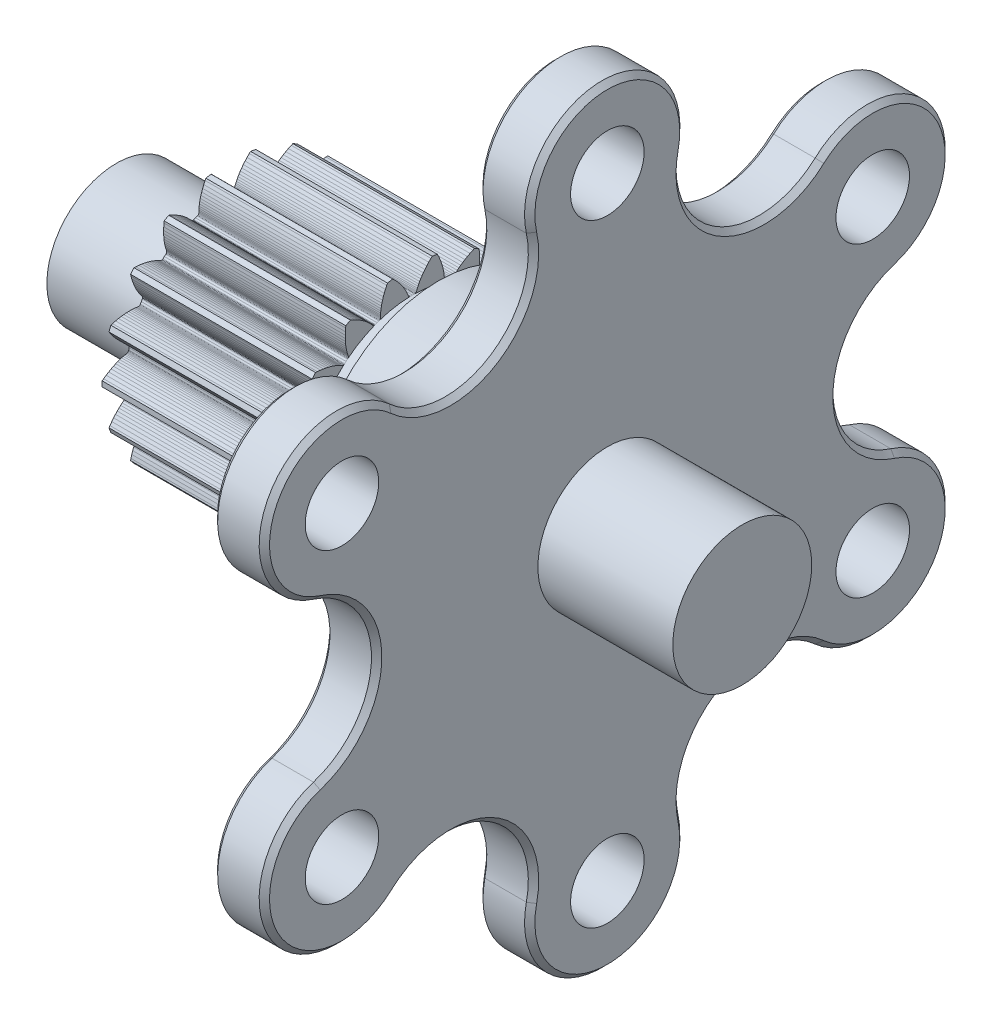
from build123d import *

# Parameters (mm, degrees)
SKETCH1_R              = 47
BASE_EXTRUDE_DEPTH     = 6.35
M8_CLEARANCE_HOLES_D   = 9
CIRPATTERN_COUNT       = 6
CUT_EXTRUDE_DEPTH      = 67.770670957
CUT_EXTRUDE_DEPTH_BACK = 67.770670957
CHAMFER1_SIZE          = 0.635
SKETCH8_R              = 15.748
SHAFT_EXTRUDE_DEPTH    = 52.5820005
CHAMFER3_SIZE          = 0.635
SHAFT_CHAMFER_SIZE     = 1
CUT_EXTRUDE1_START     = -12.856999432
SKETCH45_R             = 15.748
SKETCH45_R_2           = 8.5127
CUT_EXTRUDE1_DEPTH     = 12.856999432
SKETCH55_R             = 8.5
BOSS_EXTRUDE4_DEPTH    = 16.51
SKETCH56_R             = 8.5127
BOSS_EXTRUDE5_DEPTH    = 1.143
FILLET9_R              = 1.524
SKETCH66_R             = 13.97
SKETCH66_R_2           = 12.3825
CUT_EXTRUDE11_DEPTH    = 2.54
CUT_EXTRUDE16_START    = -22.225
CUT_EXTRUDE16_DEPTH    = 22.225
CUT_EXTRUDE17_START    = -3.175
SKETCH90_R             = 15.748
SKETCH90_R_2           = 12.650042794
CUT_EXTRUDE17_DEPTH    = 3.175
BOSS_EXTRUDE11_START   = -3.175
SKETCH91_R             = 15.748
BOSS_EXTRUDE11_DEPTH   = 3.175
BOSS_EXTRUDE12_START   = 3.175
SKETCH92_R             = 12.650042794
BOSS_EXTRUDE12_DEPTH   = 3.175


with BuildPart() as part:
    # Sketch1 → Base-Extrude (new body)
    with BuildSketch(Plane(origin=(0, 0, 0), x_dir=(0, 0, -1), z_dir=(1, 0, 0))):
        Circle(SKETCH1_R)
    extrude(amount=-BASE_EXTRUDE_DEPTH)

    # M8 Clearance Holes (through all)
    with Locations(Plane(origin=(0, 0, 0), x_dir=(0, 0, -1), z_dir=(1, 0, 0))):
        with Locations((0, -37.5)):
            m8_clearance_holes = Hole(M8_CLEARANCE_HOLES_D / 2)

    # CirPattern: M8 Clearance Holes ×6 about axis
    cirpattern_axis = Axis((-6.35, 0, 0), (1, 0, 0))
    for i in range(1, CIRPATTERN_COUNT):
        add(m8_clearance_holes.rotate(cirpattern_axis, i * 360 / CIRPATTERN_COUNT), mode=Mode.SUBTRACT)

    # Sketch19 → Cut-Extrude (cut, two sides: drawn at the far end of the back side and taken through both)
    with BuildSketch(Plane(origin=(0, 0, 0), x_dir=(0, 0, -1), z_dir=(1, 0, 0)).offset(-CUT_EXTRUDE_DEPTH_BACK)):
        with BuildLine():
            ThreePointArc((9.274838239, 35.443941724), (14.114033661, 24.446223401), (26.057934823, 25.754216393))
            ThreePointArc((26.057934823, 25.754216393), (33.921184851, 28.139425108), (40.703194264, 23.499999504))
            ThreePointArc((40.703194264, 23.499999504), (23.500000227, 40.703193847), (-4.7e-08, 47))
            ThreePointArc((-4.7e-08, 47), (7.40886473, 43.446320157), (9.274838239, 35.443941724))
        make_face()
        with BuildLine():
            ThreePointArc((-26.057934823, 25.754216393), (-14.114033661, 24.446223401), (-9.274838239, 35.443941724))
            ThreePointArc((-9.274838239, 35.443941724), (-7.40886476, 43.44632012), (-4.7e-08, 47))
            ThreePointArc((-4.7e-08, 47), (-23.500000787, 40.703193523), (-40.703194863, 23.499998466))
            ThreePointArc((-40.703194863, 23.499998466), (-33.921185443, 28.139425017), (-26.057934823, 25.754216393))
        make_face()
        with BuildLine():
            ThreePointArc((40.703193464, -23.50000089), (47, -8e-07), (40.703194264, 23.499999504))
            ThreePointArc((40.703194264, 23.499999504), (41.33004921, 15.30689472), (35.332773062, 9.689725331))
            ThreePointArc((35.332773062, 9.689725331), (28.228067323, 0), (35.332773062, -9.689725331))
            ThreePointArc((35.332773062, -9.689725331), (41.330049499, -15.306895465), (40.703193464, -23.50000089))
        make_face()
        with BuildLine():
            ThreePointArc((-35.332773062, 9.689725331), (-41.330048992, 15.306894161), (-40.703194863, 23.499998466))
            ThreePointArc((-40.703194863, 23.499998466), (-47, -6.9e-08), (-40.703194794, -23.499998586))
            ThreePointArc((-40.703194794, -23.499998586), (-41.330049018, -15.306894226), (-35.332773062, -9.689725331))
            ThreePointArc((-35.332773062, -9.689725331), (-28.228067323, 0), (-35.332773062, 9.689725331))
        make_face()
        with BuildLine():
            ThreePointArc((-26.057934823, -25.754216393), (-33.921185375, -28.139425028), (-40.703194794, -23.499998586))
            ThreePointArc((-40.703194794, -23.499998586), (-23.500000688, -40.703193581), (4.4e-08, -47))
            ThreePointArc((4.4e-08, -47), (-7.408864732, -43.446320155), (-9.274838239, -35.443941724))
            ThreePointArc((-9.274838239, -35.443941724), (-14.114033661, -24.446223401), (-26.057934823, -25.754216393))
        make_face()
        with BuildLine():
            ThreePointArc((4.4e-08, -47), (23.499999574, -40.703194224), (40.703193464, -23.50000089))
            ThreePointArc((40.703193464, -23.50000089), (33.92118406, -28.13942523), (26.057934823, -25.754216393))
            ThreePointArc((26.057934823, -25.754216393), (14.114033661, -24.446223401), (9.274838239, -35.443941724))
            ThreePointArc((9.274838239, -35.443941724), (7.408864759, -43.446320121), (4.4e-08, -47))
        make_face()
    extrude(amount=CUT_EXTRUDE_DEPTH + CUT_EXTRUDE_DEPTH_BACK, mode=Mode.SUBTRACT)

    # Chamfer1
    chamfer1_edges = [part.edges().sort_by_distance(p)[0] for p in [
        (-6.35, 0, 28.228067323),
        (-6.35, -23.5, 40.703193978),
        (-6.35, 23.5, 40.703193978),
        (-6.35, -24.446223401, 14.114033661),
        (-6.35, 24.446223401, 14.114033661),
        (-6.35, -47, 0),
        (-6.35, 47, 0),
        (-6.35, -24.446223401, -14.114033661),
        (-6.35, -23.5, -40.703193978),
        (-6.35, 0, -28.228067323),
        (-6.35, 23.5, -40.703193978),
        (-6.35, 24.446223401, -14.114033661),
    ]]
    chamfer(chamfer1_edges, length=CHAMFER1_SIZE)

    # Sketch8 → Shaft-Extrude (add)
    with BuildSketch(Plane.ZY.offset(6.35)):
        Circle(SKETCH8_R)
    extrude(amount=SHAFT_EXTRUDE_DEPTH)

    # Chamfer3
    chamfer3_edges = [part.edges().sort_by_distance(p)[0] for p in [
        (0, -23.5, 40.703193978),
        (0, 0, 28.228067323),
        (0, -24.446223401, 14.114033661),
        (0, 23.5, 40.703193978),
        (0, -47, 0),
        (0, 24.446223401, 14.114033661),
        (0, -24.446223401, -14.114033661),
        (0, 47, 0),
        (0, 24.446223401, -14.114033661),
        (0, -23.5, -40.703193978),
        (0, 0, -28.228067323),
        (0, 23.5, -40.703193978),
    ]]
    chamfer(chamfer3_edges, length=CHAMFER3_SIZE)

    # Shaft Chamfer
    shaft_chamfer_edges = [part.edges().sort_by_distance(p)[0] for p in [
        (-58.9320005, 0, -15.748),
    ]]
    chamfer(shaft_chamfer_edges, length=SHAFT_CHAMFER_SIZE)

    # Sketch45 → Cut-Extrude1 (cut)
    with BuildSketch(Plane.ZY.offset(58.9320005).offset(CUT_EXTRUDE1_START)):
        Circle(SKETCH45_R)
        Circle(SKETCH45_R_2, mode=Mode.SUBTRACT)
    extrude(amount=CUT_EXTRUDE1_DEPTH, mode=Mode.SUBTRACT)

    # Sketch55 → Boss-Extrude4 (add)
    with BuildSketch(Plane(origin=(0, 0, 0), x_dir=(0, 0, -1), z_dir=(1, 0, 0))):
        Circle(SKETCH55_R)
    extrude(amount=BOSS_EXTRUDE4_DEPTH)

    # Sketch56 → Boss-Extrude5 (add)
    with BuildSketch(Plane.ZY.offset(58.9320005)):
        Circle(SKETCH56_R)
    extrude(amount=BOSS_EXTRUDE5_DEPTH)

    # Fillet9
    fillet9_edges = [part.edges().sort_by_distance(p)[0] for p in [
        (-46.075001068, 0, -8.5127),
    ]]
    fillet(fillet9_edges, radius=FILLET9_R)

    # Sketch66 → Cut-Extrude11 (cut)
    with BuildSketch(Plane.ZY.offset(22.0004005)):
        Circle(SKETCH66_R)
        Circle(SKETCH66_R_2, mode=Mode.SUBTRACT)
    extrude(amount=-CUT_EXTRUDE11_DEPTH, mode=Mode.SUBTRACT)

    # Sketch89 → Cut-Extrude16 (cut)
    with BuildSketch(Plane.ZY.offset(46.075001068).offset(CUT_EXTRUDE16_START)):
        with BuildLine():
            Line((14.905662373, 5.081410553), (14.7872836, 4.8999562))
            Line((14.7872836, 4.8999562), (14.5639901, 4.5862254))
            Line((14.5639901, 4.5862254), (14.3413189, 4.2995436))
            Line((14.3413189, 4.2995436), (14.1194165, 4.0372965))
            Line((14.1194165, 4.0372965), (13.9032487, 3.8025328))
            Line((13.9032487, 3.8025328), (13.6912318, 3.5907592))
            Line((13.6912318, 3.5907592), (13.4871377, 3.4033311))
            Line((13.4871377, 3.4033311), (13.2928477, 3.2393112))
            Line((13.2928477, 3.2393112), (13.106944, 3.0952812))
            Line((13.106944, 3.0952812), (12.9348864, 2.9731584))
            Line((12.9348864, 2.9731584), (12.774825, 2.8693266))
            Line((12.774825, 2.8693266), (12.6451501, 2.7921869))
            Line((12.6451501, 2.7921869), (12.5432319, 2.7213528))
            Line((12.5432319, 2.7213528), (12.5028003, 2.684827))
            Line((12.5028003, 2.684827), (12.469389, 2.6479348))
            Line((12.469389, 2.6479348), (12.4430003, 2.6109505))
            Line((12.4430003, 2.6109505), (12.4236152, 2.5741554))
            Line((12.4236152, 2.5741554), (12.4112164, 2.5378203))
            Line((12.4112164, 2.5378203), (12.4057633, 2.5022327))
            Line((12.4057633, 2.5022327), (12.4072206, 2.4676504))
            Line((12.4072206, 2.4676504), (12.4155284, 2.4245076))
            Line((12.4155284, 2.4245076), (12.4578181, 2.1966494))
            Line((12.4578181, 2.1966494), (12.4960109, 1.9680689))
            Line((12.4960109, 1.9680689), (12.5029598, 1.9246865))
            Line((12.5029598, 1.9246865), (12.5134182, 1.8916913))
            Line((12.5134182, 1.8916913), (12.5307141, 1.860115))
            Line((12.5307141, 1.860115), (12.5547926, 1.8302119))
            Line((12.5547926, 1.8302119), (12.5855933, 1.8022658))
            Line((12.5855933, 1.8022658), (12.6230398, 1.7765375))
            Line((12.6230398, 1.7765375), (12.6670541, 1.7532974))
            Line((12.6670541, 1.7532974), (12.71754, 1.7328028))
            Line((12.71754, 1.7328028), (12.8375384, 1.7010987))
            Line((12.8375384, 1.7010987), (12.9857762, 1.6729624))
            Line((12.9857762, 1.6729624), (13.1716974, 1.6301367))
            Line((13.1716974, 1.6301367), (13.3751471, 1.5742259))
            Line((13.3751471, 1.5742259), (13.5991006, 1.5024649))
            Line((13.5991006, 1.5024649), (13.8377716, 1.4147876))
            Line((13.8377716, 1.4147876), (14.0936614, 1.3084672))
            Line((14.0936614, 1.3084672), (14.365323, 1.1819791))
            Line((14.365323, 1.1819791), (14.6487482, 1.0353071))
            Line((14.6487482, 1.0353071), (14.9469621, 0.8647705))
            Line((14.9469621, 0.8647705), (15.2542554, 0.6715358))
            Line((15.2542554, 0.6715358), (15.571385, 0.4530962))
            Line((15.571385, 0.4530962), (15.744685707, 0.323072753))
            ThreePointArc((15.744685707, 0.323072753), (15.508752497, 2.734611488), (14.905662373, 5.081410553))
        make_face()
        with BuildLine():
            Line((14.4773476, 5.7514985), (14.68466758, 5.688588758))
            ThreePointArc((14.68466758, 5.688588758), (13.638168057, 7.874000004), (12.268796161, 9.873000798))
            Line((12.268796161, 9.873000798), (12.2196176, 9.6620015))
            Line((12.2196176, 9.6620015), (12.1170925, 9.2908201))
            Line((12.1170925, 9.2908201), (12.0059011, 8.9452694))
            Line((12.0059011, 8.9452694), (11.8870747, 8.6229426))
            Line((11.8870747, 8.6229426), (11.7642374, 8.3284031))
            Line((11.7642374, 8.3284031), (11.6374375, 8.0568869))
            Line((11.6374375, 8.0568869), (11.509756, 7.8109579))
            Line((11.509756, 7.8109579), (11.3832812, 7.5903785))
            Line((11.3832812, 7.5903785), (11.25785, 7.3914518))
            Line((11.25785, 7.3914518), (11.1379373, 7.2178467))
            Line((11.1379373, 7.2178467), (11.0230413, 7.0655325))
            Line((11.0230413, 7.0655325), (10.9275701, 6.9486934))
            Line((10.9275701, 6.9486934), (10.856025, 6.8472732))
            Line((10.856025, 6.8472732), (10.8305243, 6.7991217))
            Line((10.8305243, 6.7991217), (10.8117458, 6.753027))
            Line((10.8117458, 6.753027), (10.7995979, 6.7092477))
            Line((10.7995979, 6.7092477), (10.7939666, 6.6680415))
            Line((10.7939666, 6.6680415), (10.7947428, 6.629657))
            Line((10.7947428, 6.629657), (10.8017902, 6.5943506))
            Line((10.8017902, 6.5943506), (10.8149875, 6.5623522))
            Line((10.8149875, 6.5623522), (10.83755, 6.5246527))
            Line((10.83755, 6.5246527), (10.9552214, 6.325))
            Line((10.9552214, 6.325), (11.06929, 6.1232673))
            Line((11.06929, 6.1232673), (11.0906575, 6.0848778))
            Line((11.0906575, 6.0848778), (11.1117702, 6.0574494))
            Line((11.1117702, 6.0574494), (11.1388228, 6.033693))
            Line((11.1388228, 6.033693), (11.1716766, 6.0138285))
            Line((11.1716766, 6.0138285), (11.2101779, 5.9981023))
            Line((11.2101779, 5.9981023), (11.2541658, 5.986733))
            Line((11.2541658, 5.986733), (11.3034743, 5.9799483))
            Line((11.3034743, 5.9799483), (11.357925, 5.9779568))
            Line((11.357925, 5.9779568), (11.4815301, 5.9892066))
            Line((11.4815301, 5.9892066), (11.6304513, 6.0134675))
            Line((11.6304513, 6.0134675), (11.8198073, 6.0368133))
            Line((11.8198073, 6.0368133), (12.03011, 6.0538582))
            Line((12.03011, 6.0538582), (12.2651012, 6.0630215))
            Line((12.2651012, 6.0630215), (12.519366, 6.0622621))
            Line((12.519366, 6.0622621), (12.7961875, 6.0498731))
            Line((12.7961875, 6.0498731), (13.0947274, 6.0239269))
            Line((13.0947274, 6.0239269), (13.4112247, 5.9830374))
            Line((13.4112247, 5.9830374), (13.7497811, 5.9247806))
            Line((13.7497811, 5.9247806), (14.1046325, 5.8482999))
            Line((14.1046325, 5.8482999), (14.4773476, 5.7514985))
        make_face()
        with BuildLine():
            ThreePointArc((14.905662372, -5.081410558), (15.508752496, -2.734611494), (15.744685706, -0.323072759))
            Line((15.744685706, -0.323072759), (15.571385, -0.4530962))
            Line((15.571385, -0.4530962), (15.2542554, -0.6715358))
            Line((15.2542554, -0.6715358), (14.9469621, -0.8647705))
            Line((14.9469621, -0.8647705), (14.6487482, -1.0353071))
            Line((14.6487482, -1.0353071), (14.365323, -1.1819791))
            Line((14.365323, -1.1819791), (14.0936614, -1.3084672))
            Line((14.0936614, -1.3084672), (13.8377716, -1.4147876))
            Line((13.8377716, -1.4147876), (13.5991006, -1.5024649))
            Line((13.5991006, -1.5024649), (13.3751471, -1.5742259))
            Line((13.3751471, -1.5742259), (13.1716974, -1.6301367))
            Line((13.1716974, -1.6301367), (12.9857762, -1.6729624))
            Line((12.9857762, -1.6729624), (12.8375384, -1.7010987))
            Line((12.8375384, -1.7010987), (12.71754, -1.7328028))
            Line((12.71754, -1.7328028), (12.6670541, -1.7532974))
            Line((12.6670541, -1.7532974), (12.6230398, -1.7765375))
            Line((12.6230398, -1.7765375), (12.5855933, -1.8022658))
            Line((12.5855933, -1.8022658), (12.5547926, -1.8302119))
            Line((12.5547926, -1.8302119), (12.5307141, -1.860115))
            Line((12.5307141, -1.860115), (12.5134182, -1.8916913))
            Line((12.5134182, -1.8916913), (12.5029598, -1.9246865))
            Line((12.5029598, -1.9246865), (12.4960109, -1.9680689))
            Line((12.4960109, -1.9680689), (12.4578181, -2.1966494))
            Line((12.4578181, -2.1966494), (12.4155284, -2.4245076))
            Line((12.4155284, -2.4245076), (12.4072206, -2.4676504))
            Line((12.4072206, -2.4676504), (12.4057633, -2.5022327))
            Line((12.4057633, -2.5022327), (12.4112164, -2.5378203))
            Line((12.4112164, -2.5378203), (12.4236152, -2.5741554))
            Line((12.4236152, -2.5741554), (12.4430003, -2.6109505))
            Line((12.4430003, -2.6109505), (12.469389, -2.6479348))
            Line((12.469389, -2.6479348), (12.5028003, -2.684827))
            Line((12.5028003, -2.684827), (12.5432319, -2.7213528))
            Line((12.5432319, -2.7213528), (12.6451501, -2.7921869))
            Line((12.6451501, -2.7921869), (12.774825, -2.8693266))
            Line((12.774825, -2.8693266), (12.9348864, -2.9731584))
            Line((12.9348864, -2.9731584), (13.106944, -3.0952812))
            Line((13.106944, -3.0952812), (13.2928477, -3.2393112))
            Line((13.2928477, -3.2393112), (13.4871377, -3.4033311))
            Line((13.4871377, -3.4033311), (13.6912318, -3.5907592))
            Line((13.6912318, -3.5907592), (13.9032487, -3.8025328))
            Line((13.9032487, -3.8025328), (14.1194165, -4.0372965))
            Line((14.1194165, -4.0372965), (14.3413189, -4.2995436))
            Line((14.3413189, -4.2995436), (14.5639901, -4.5862254))
            Line((14.5639901, -4.5862254), (14.7872836, -4.8999562))
            Line((14.7872836, -4.8999562), (14.905662372, -5.081410558))
        make_face()
        with BuildLine():
            Line((11.6371283, 10.3561852), (11.853461816, 10.367976995))
            ThreePointArc((11.853461816, 10.367976995), (10.122619272, 12.063667894), (8.152132074, 13.473761414))
            Line((8.152132074, 13.473761414), (8.1780853, 13.2586669))
            Line((8.1780853, 13.2586669), (8.2086948, 12.8748048))
            Line((8.2086948, 12.8748048), (8.2223943, 12.5120636))
            Line((8.2223943, 12.5120636), (8.2209763, 12.1685346))
            Line((8.2209763, 12.1685346), (8.2062854, 11.8497451))
            Line((8.2062854, 11.8497451), (8.1799965, 11.5512353))
            Line((8.1799965, 11.5512353), (8.1441278, 11.2764679))
            Line((8.1441278, 11.2764679), (8.100723, 11.0259342))
            Line((8.100723, 11.0259342), (8.0508932, 10.7961042))
            Line((8.0508932, 10.7961042), (7.9975885, 10.5919562))
            Line((7.9975885, 10.5919562), (7.9417161, 10.4095309))
            Line((7.9417161, 10.4095309), (7.8919638, 10.267085))
            Line((7.8919638, 10.267085), (7.8594212, 10.1473113))
            Line((7.8594212, 10.1473113), (7.8519271, 10.093342))
            Line((7.8519271, 10.093342), (7.8500465, 10.0436044))
            Line((7.8500465, 10.0436044), (7.8536046, 9.9983106))
            Line((7.8536046, 9.9983106), (7.8624063, 9.9576633))
            Line((7.8624063, 9.9576633), (7.8762639, 9.9218593))
            Line((7.8762639, 9.9218593), (7.8949618, 9.8910924))
            Line((7.8949618, 9.8910924), (7.9183073, 9.8655375))
            Line((7.9183073, 9.8655375), (7.9524031, 9.8378284))
            Line((7.9524031, 9.8378284), (8.1312633, 9.6904622))
            Line((8.1312633, 9.6904622), (8.3074494, 9.5399092))
            Line((8.3074494, 9.5399092), (8.3406582, 9.511143))
            Line((8.3406582, 9.511143), (8.3698787, 9.4925898))
            Line((8.3698787, 9.4925898), (8.403425, 9.4795185))
            Line((8.403425, 9.4795185), (8.4410916, 9.4720887))
            Line((8.4410916, 9.4720887), (8.4826497, 9.4704791))
            Line((8.4826497, 9.4704791), (8.5278733, 9.4748403))
            Line((8.5278733, 9.4748403), (8.5765286, 9.4853292))
            Line((8.5765286, 9.4853292), (8.6283766, 9.5020811))
            Line((8.6283766, 9.5020811), (8.7406798, 9.5549278))
            Line((8.7406798, 9.5549278), (8.8723222, 9.6286596))
            Line((8.8723222, 9.6286596), (9.0422739, 9.7153611))
            Line((9.0422739, 9.7153611), (9.2340642, 9.8033059))
            Line((9.2340642, 9.8033059), (9.4517497, 9.8922882))
            Line((9.4517497, 9.8922882), (9.6909401, 9.9785383))
            Line((9.6909401, 9.9785383), (9.9553045, 10.061575))
            Line((9.9553045, 10.061575), (10.2447144, 10.1393002))
            Line((10.2447144, 10.1393002), (10.5561096, 10.2091251))
            Line((10.5561096, 10.2091251), (10.8941735, 10.2701747))
            Line((10.8941735, 10.2701747), (11.2537827, 10.3196727))
            Line((11.2537827, 10.3196727), (11.6371283, 10.3561852))
        make_face()
        with BuildLine():
            ThreePointArc((12.268796171, -9.873000785), (13.63816806, -7.873999998), (14.684667579, -5.688588761))
            Line((14.684667579, -5.688588761), (14.4773476, -5.7514985))
            Line((14.4773476, -5.7514985), (14.1046325, -5.8482999))
            Line((14.1046325, -5.8482999), (13.7497811, -5.9247806))
            Line((13.7497811, -5.9247806), (13.4112247, -5.9830374))
            Line((13.4112247, -5.9830374), (13.0947274, -6.0239269))
            Line((13.0947274, -6.0239269), (12.7961875, -6.0498731))
            Line((12.7961875, -6.0498731), (12.519366, -6.0622621))
            Line((12.519366, -6.0622621), (12.2651012, -6.0630215))
            Line((12.2651012, -6.0630215), (12.03011, -6.0538582))
            Line((12.03011, -6.0538582), (11.8198073, -6.0368133))
            Line((11.8198073, -6.0368133), (11.6304513, -6.0134675))
            Line((11.6304513, -6.0134675), (11.4815301, -5.9892066))
            Line((11.4815301, -5.9892066), (11.357925, -5.9779568))
            Line((11.357925, -5.9779568), (11.3034743, -5.9799483))
            Line((11.3034743, -5.9799483), (11.2541658, -5.986733))
            Line((11.2541658, -5.986733), (11.2101779, -5.9981023))
            Line((11.2101779, -5.9981023), (11.1716766, -6.0138285))
            Line((11.1716766, -6.0138285), (11.1388228, -6.033693))
            Line((11.1388228, -6.033693), (11.1117702, -6.0574494))
            Line((11.1117702, -6.0574494), (11.0906575, -6.0848778))
            Line((11.0906575, -6.0848778), (11.06929, -6.1232673))
            Line((11.06929, -6.1232673), (10.9552214, -6.325))
            Line((10.9552214, -6.325), (10.83755, -6.5246527))
            Line((10.83755, -6.5246527), (10.8149875, -6.5623522))
            Line((10.8149875, -6.5623522), (10.8017902, -6.5943506))
            Line((10.8017902, -6.5943506), (10.7947428, -6.629657))
            Line((10.7947428, -6.629657), (10.7939666, -6.6680415))
            Line((10.7939666, -6.6680415), (10.7995979, -6.7092477))
            Line((10.7995979, -6.7092477), (10.8117458, -6.753027))
            Line((10.8117458, -6.753027), (10.8305243, -6.7991217))
            Line((10.8305243, -6.7991217), (10.856025, -6.8472732))
            Line((10.856025, -6.8472732), (10.9275701, -6.9486934))
            Line((10.9275701, -6.9486934), (11.0230413, -7.0655325))
            Line((11.0230413, -7.0655325), (11.1379373, -7.2178467))
            Line((11.1379373, -7.2178467), (11.25785, -7.3914518))
            Line((11.25785, -7.3914518), (11.3832812, -7.5903785))
            Line((11.3832812, -7.5903785), (11.509756, -7.8109579))
            Line((11.509756, -7.8109579), (11.6374375, -8.0568869))
            Line((11.6374375, -8.0568869), (11.7642374, -8.3284031))
            Line((11.7642374, -8.3284031), (11.8870747, -8.6229426))
            Line((11.8870747, -8.6229426), (12.0059011, -8.9452694))
            Line((12.0059011, -8.9452694), (12.1170925, -9.2908201))
            Line((12.1170925, -9.2908201), (12.2196176, -9.6620015))
            Line((12.2196176, -9.6620015), (12.268796171, -9.873000785))
        make_face()
        with BuildLine():
            Line((7.3932997, 13.7117631), (7.592553638, 13.796834175))
            ThreePointArc((7.592553638, 13.796834175), (5.386133218, 14.798279392), (3.052200538, 15.449387557))
            Line((3.052200538, 15.449387557), (3.1501553, 15.2561413))
            Line((3.1501553, 15.2561413), (3.3102073, 14.9058981))
            Line((3.3102073, 14.9058981), (3.4471455, 14.5697183))
            Line((3.4471455, 14.5697183), (3.5633069, 14.2464216))
            Line((3.5633069, 14.2464216), (3.6585343, 13.941833))
            Line((3.6585343, 13.941833), (3.7359273, 13.6523341))
            Line((3.7359273, 13.6523341), (3.7961976, 13.3818694))
            Line((3.7961976, 13.3818694), (3.8410981, 13.1315994))
            Line((3.8410981, 13.1315994), (3.8728798, 12.8985871))
            Line((3.8728798, 12.8985871), (3.8926125, 12.6885195))
            Line((3.8926125, 12.6885195), (3.9025028, 12.4979862))
            Line((3.9025028, 12.4979862), (3.9044703, 12.3471146))
            Line((3.9044703, 12.3471146), (3.9148553, 12.2234339))
            Line((3.9148553, 12.2234339), (3.9262717, 12.1701562))
            Line((3.9262717, 12.1701562), (3.9415157, 12.122775))
            Line((3.9415157, 12.122775), (3.9603507, 12.0814297))
            Line((3.9603507, 12.0814297), (3.9825237, 12.0462441))
            Line((3.9825237, 12.0462441), (4.0077913, 12.0173388))
            Line((4.0077913, 12.0173388), (4.0358845, 11.9948225))
            Line((4.0358845, 11.9948225), (4.0665624, 11.9787934))
            Line((4.0665624, 11.9787934), (4.108079, 11.9644168))
            Line((4.108079, 11.9644168), (4.3265548, 11.8871117))
            Line((4.3265548, 11.8871117), (4.5436078, 11.8058973))
            Line((4.5436078, 11.8058973), (4.5846525, 11.790224))
            Line((4.5846525, 11.790224), (4.6184564, 11.7827837))
            Line((4.6184564, 11.7827837), (4.6544502, 11.7819743))
            Line((4.6544502, 11.7819743), (4.6923863, 11.7878752))
            Line((4.6923863, 11.7878752), (4.7319887, 11.8005764))
            Line((4.7319887, 11.8005764), (4.7729934, 11.8201419))
            Line((4.7729934, 11.8201419), (4.815127, 11.8466394))
            Line((4.815127, 11.8466394), (4.8581187, 11.8801141))
            Line((4.8581187, 11.8801141), (4.9455745, 11.9681837))
            Line((4.9455745, 11.9681837), (5.0440601, 12.0824933))
            Line((5.0440601, 12.0824933), (5.1741089, 12.2220929))
            Line((5.1741089, 12.2220929), (5.3242539, 12.3703301))
            Line((5.3242539, 12.3703301), (5.4983776, 12.528399))
            Line((5.4983776, 12.528399), (5.6936438, 12.6912555))
            Line((5.6936438, 12.6912555), (5.9136649, 12.8597024))
            Line((5.9136649, 12.8597024), (6.1590376, 13.0317242))
            Line((6.1590376, 13.0317242), (6.4277719, 13.2038416))
            Line((6.4277719, 13.2038416), (6.7245678, 13.3768342))
            Line((6.7245678, 13.3768342), (7.0455607, 13.5463406))
            Line((7.0455607, 13.5463406), (7.3932997, 13.7117631))
        make_face()
        with BuildLine():
            ThreePointArc((8.152132052, -13.473761428), (10.122619257, -12.063667907), (11.853461807, -10.367977006))
            Line((11.853461807, -10.367977006), (11.6371283, -10.3561852))
            Line((11.6371283, -10.3561852), (11.2537827, -10.3196727))
            Line((11.2537827, -10.3196727), (10.8941735, -10.2701747))
            Line((10.8941735, -10.2701747), (10.5561096, -10.2091251))
            Line((10.5561096, -10.2091251), (10.2447144, -10.1393002))
            Line((10.2447144, -10.1393002), (9.9553045, -10.061575))
            Line((9.9553045, -10.061575), (9.6909401, -9.9785383))
            Line((9.6909401, -9.9785383), (9.4517497, -9.8922882))
            Line((9.4517497, -9.8922882), (9.2340642, -9.8033059))
            Line((9.2340642, -9.8033059), (9.0422739, -9.7153611))
            Line((9.0422739, -9.7153611), (8.8723222, -9.6286596))
            Line((8.8723222, -9.6286596), (8.7406798, -9.5549278))
            Line((8.7406798, -9.5549278), (8.6283766, -9.5020811))
            Line((8.6283766, -9.5020811), (8.5765286, -9.4853292))
            Line((8.5765286, -9.4853292), (8.5278733, -9.4748403))
            Line((8.5278733, -9.4748403), (8.4826497, -9.4704791))
            Line((8.4826497, -9.4704791), (8.4410916, -9.4720887))
            Line((8.4410916, -9.4720887), (8.403425, -9.4795185))
            Line((8.403425, -9.4795185), (8.3698787, -9.4925898))
            Line((8.3698787, -9.4925898), (8.3406582, -9.511143))
            Line((8.3406582, -9.511143), (8.3074494, -9.5399092))
            Line((8.3074494, -9.5399092), (8.1312633, -9.6904622))
            Line((8.1312633, -9.6904622), (7.9524031, -9.8378284))
            Line((7.9524031, -9.8378284), (7.9183073, -9.8655375))
            Line((7.9183073, -9.8655375), (7.8949618, -9.8910924))
            Line((7.8949618, -9.8910924), (7.8762639, -9.9218593))
            Line((7.8762639, -9.9218593), (7.8624063, -9.9576633))
            Line((7.8624063, -9.9576633), (7.8536046, -9.9983106))
            Line((7.8536046, -9.9983106), (7.8500465, -10.0436044))
            Line((7.8500465, -10.0436044), (7.8519271, -10.093342))
            Line((7.8519271, -10.093342), (7.8594212, -10.1473113))
            Line((7.8594212, -10.1473113), (7.8919638, -10.267085))
            Line((7.8919638, -10.267085), (7.9417161, -10.4095309))
            Line((7.9417161, -10.4095309), (7.9975885, -10.5919562))
            Line((7.9975885, -10.5919562), (8.0508932, -10.7961042))
            Line((8.0508932, -10.7961042), (8.100723, -11.0259342))
            Line((8.100723, -11.0259342), (8.1441278, -11.2764679))
            Line((8.1441278, -11.2764679), (8.1799965, -11.5512353))
            Line((8.1799965, -11.5512353), (8.2062854, -11.8497451))
            Line((8.2062854, -11.8497451), (8.2209763, -12.1685346))
            Line((8.2209763, -12.1685346), (8.2223943, -12.5120636))
            Line((8.2223943, -12.5120636), (8.2086948, -12.8748048))
            Line((8.2086948, -12.8748048), (8.1780853, -13.2586669))
            Line((8.1780853, -13.2586669), (8.152132052, -13.473761428))
        make_face()
        with BuildLine():
            Line((2.25773, 15.4135), (2.415871395, 15.561589553))
            ThreePointArc((2.415871395, 15.561589553), (-3.4e-08, 15.748), (-2.415871463, 15.561589542))
            Line((-2.415871463, 15.561589542), (-2.25773, 15.4135))
            Line((-2.25773, 15.4135), (-1.98754, 15.13912))
            Line((-1.98754, 15.13912), (-1.74388, 14.87005))
            Line((-1.74388, 14.87005), (-1.52415, 14.60598))
            Line((-1.52415, 14.60598), (-1.33049, 14.35233))
            Line((-1.33049, 14.35233), (-1.15875, 14.10676))
            Line((-1.15875, 14.10676), (-1.00961, 13.87322))
            Line((-1.00961, 13.87322), (-0.88182, 13.6534))
            Line((-0.88182, 13.6534), (-0.77226, 13.44531))
            Line((-0.77226, 13.44531), (-0.68187, 13.25466))
            Line((-0.68187, 13.25466), (-0.60741, 13.079))
            Line((-0.60741, 13.079), (-0.55396, 12.9379))
            Line((-0.55396, 12.9379), (-0.5019, 12.82523))
            Line((-0.5019, 12.82523), (-0.47295, 12.77907))
            Line((-0.47295, 12.77907), (-0.44242, 12.73976))
            Line((-0.44242, 12.73976), (-0.41058, 12.70735))
            Line((-0.41058, 12.70735), (-0.37771, 12.68187))
            Line((-0.37771, 12.68187), (-0.34408, 12.66335))
            Line((-0.34408, 12.66335), (-0.30998, 12.6518))
            Line((-0.30998, 12.6518), (-0.27567, 12.64723))
            Line((-0.27567, 12.64723), (-0.23174, 12.64792))
            Line((-0.23174, 12.64792), (0, 12.65))
            Line((0, 12.65), (0.23174, 12.64792))
            Line((0.23174, 12.64792), (0.27567, 12.64723))
            Line((0.27567, 12.64723), (0.30998, 12.6518))
            Line((0.30998, 12.6518), (0.34408, 12.66335))
            Line((0.34408, 12.66335), (0.37771, 12.68187))
            Line((0.37771, 12.68187), (0.41058, 12.70735))
            Line((0.41058, 12.70735), (0.44242, 12.73976))
            Line((0.44242, 12.73976), (0.47295, 12.77907))
            Line((0.47295, 12.77907), (0.5019, 12.82523))
            Line((0.5019, 12.82523), (0.55396, 12.9379))
            Line((0.55396, 12.9379), (0.60741, 13.079))
            Line((0.60741, 13.079), (0.68187, 13.25466))
            Line((0.68187, 13.25466), (0.77226, 13.44531))
            Line((0.77226, 13.44531), (0.88182, 13.6534))
            Line((0.88182, 13.6534), (1.00961, 13.87322))
            Line((1.00961, 13.87322), (1.15875, 14.10676))
            Line((1.15875, 14.10676), (1.33049, 14.35233))
            Line((1.33049, 14.35233), (1.52415, 14.60598))
            Line((1.52415, 14.60598), (1.74388, 14.87005))
            Line((1.74388, 14.87005), (1.98754, 15.13912))
            Line((1.98754, 15.13912), (2.25773, 15.4135))
        make_face()
        with BuildLine():
            ThreePointArc((3.05220052, -15.44938756), (5.386133201, -14.798279398), (7.592553624, -13.796834183))
            Line((7.592553624, -13.796834183), (7.3932997, -13.7117631))
            Line((7.3932997, -13.7117631), (7.0455607, -13.5463406))
            Line((7.0455607, -13.5463406), (6.7245678, -13.3768342))
            Line((6.7245678, -13.3768342), (6.4277719, -13.2038416))
            Line((6.4277719, -13.2038416), (6.1590376, -13.0317242))
            Line((6.1590376, -13.0317242), (5.9136649, -12.8597024))
            Line((5.9136649, -12.8597024), (5.6936438, -12.6912555))
            Line((5.6936438, -12.6912555), (5.4983776, -12.528399))
            Line((5.4983776, -12.528399), (5.3242539, -12.3703301))
            Line((5.3242539, -12.3703301), (5.1741089, -12.2220929))
            Line((5.1741089, -12.2220929), (5.0440601, -12.0824933))
            Line((5.0440601, -12.0824933), (4.9455745, -11.9681837))
            Line((4.9455745, -11.9681837), (4.8581187, -11.8801141))
            Line((4.8581187, -11.8801141), (4.815127, -11.8466394))
            Line((4.815127, -11.8466394), (4.7729934, -11.8201419))
            Line((4.7729934, -11.8201419), (4.7319887, -11.8005764))
            Line((4.7319887, -11.8005764), (4.6923863, -11.7878752))
            Line((4.6923863, -11.7878752), (4.6544502, -11.7819743))
            Line((4.6544502, -11.7819743), (4.6184564, -11.7827837))
            Line((4.6184564, -11.7827837), (4.5846525, -11.790224))
            Line((4.5846525, -11.790224), (4.5436078, -11.8058973))
            Line((4.5436078, -11.8058973), (4.3265548, -11.8871117))
            Line((4.3265548, -11.8871117), (4.108079, -11.9644168))
            Line((4.108079, -11.9644168), (4.0665624, -11.9787934))
            Line((4.0665624, -11.9787934), (4.0358845, -11.9948225))
            Line((4.0358845, -11.9948225), (4.0077913, -12.0173388))
            Line((4.0077913, -12.0173388), (3.9825237, -12.0462441))
            Line((3.9825237, -12.0462441), (3.9603507, -12.0814297))
            Line((3.9603507, -12.0814297), (3.9415157, -12.122775))
            Line((3.9415157, -12.122775), (3.9262717, -12.1701562))
            Line((3.9262717, -12.1701562), (3.9148553, -12.2234339))
            Line((3.9148553, -12.2234339), (3.9044703, -12.3471146))
            Line((3.9044703, -12.3471146), (3.9025028, -12.4979862))
            Line((3.9025028, -12.4979862), (3.8926125, -12.6885195))
            Line((3.8926125, -12.6885195), (3.8728798, -12.8985871))
            Line((3.8728798, -12.8985871), (3.8410981, -13.1315994))
            Line((3.8410981, -13.1315994), (3.7961976, -13.3818694))
            Line((3.7961976, -13.3818694), (3.7359273, -13.6523341))
            Line((3.7359273, -13.6523341), (3.6585343, -13.941833))
            Line((3.6585343, -13.941833), (3.5633069, -14.2464216))
            Line((3.5633069, -14.2464216), (3.4471455, -14.5697183))
            Line((3.4471455, -14.5697183), (3.3102073, -14.9058981))
            Line((3.3102073, -14.9058981), (3.1501553, -15.2561413))
            Line((3.1501553, -15.2561413), (3.05220052, -15.44938756))
        make_face()
        with BuildLine():
            Line((-3.1501553, 15.2561413), (-3.05220052, 15.44938756))
            ThreePointArc((-3.05220052, 15.44938756), (-5.386133201, 14.798279398), (-7.592553624, 13.796834183))
            Line((-7.592553624, 13.796834183), (-7.3932997, 13.7117631))
            Line((-7.3932997, 13.7117631), (-7.0455607, 13.5463406))
            Line((-7.0455607, 13.5463406), (-6.7245678, 13.3768342))
            Line((-6.7245678, 13.3768342), (-6.4277719, 13.2038416))
            Line((-6.4277719, 13.2038416), (-6.1590376, 13.0317242))
            Line((-6.1590376, 13.0317242), (-5.9136649, 12.8597024))
            Line((-5.9136649, 12.8597024), (-5.6936438, 12.6912555))
            Line((-5.6936438, 12.6912555), (-5.4983776, 12.528399))
            Line((-5.4983776, 12.528399), (-5.3242539, 12.3703301))
            Line((-5.3242539, 12.3703301), (-5.1741089, 12.2220929))
            Line((-5.1741089, 12.2220929), (-5.0440601, 12.0824933))
            Line((-5.0440601, 12.0824933), (-4.9455745, 11.9681837))
            Line((-4.9455745, 11.9681837), (-4.8581187, 11.8801141))
            Line((-4.8581187, 11.8801141), (-4.815127, 11.8466394))
            Line((-4.815127, 11.8466394), (-4.7729934, 11.8201419))
            Line((-4.7729934, 11.8201419), (-4.7319887, 11.8005764))
            Line((-4.7319887, 11.8005764), (-4.6923863, 11.7878752))
            Line((-4.6923863, 11.7878752), (-4.6544502, 11.7819743))
            Line((-4.6544502, 11.7819743), (-4.6184564, 11.7827837))
            Line((-4.6184564, 11.7827837), (-4.5846525, 11.790224))
            Line((-4.5846525, 11.790224), (-4.5436078, 11.8058973))
            Line((-4.5436078, 11.8058973), (-4.3265548, 11.8871117))
            Line((-4.3265548, 11.8871117), (-4.108079, 11.9644168))
            Line((-4.108079, 11.9644168), (-4.0665624, 11.9787934))
            Line((-4.0665624, 11.9787934), (-4.0358845, 11.9948225))
            Line((-4.0358845, 11.9948225), (-4.0077913, 12.0173388))
            Line((-4.0077913, 12.0173388), (-3.9825237, 12.0462441))
            Line((-3.9825237, 12.0462441), (-3.9603507, 12.0814297))
            Line((-3.9603507, 12.0814297), (-3.9415157, 12.122775))
            Line((-3.9415157, 12.122775), (-3.9262717, 12.1701562))
            Line((-3.9262717, 12.1701562), (-3.9148553, 12.2234339))
            Line((-3.9148553, 12.2234339), (-3.9044703, 12.3471146))
            Line((-3.9044703, 12.3471146), (-3.9025028, 12.4979862))
            Line((-3.9025028, 12.4979862), (-3.8926125, 12.6885195))
            Line((-3.8926125, 12.6885195), (-3.8728798, 12.8985871))
            Line((-3.8728798, 12.8985871), (-3.8410981, 13.1315994))
            Line((-3.8410981, 13.1315994), (-3.7961976, 13.3818694))
            Line((-3.7961976, 13.3818694), (-3.7359273, 13.6523341))
            Line((-3.7359273, 13.6523341), (-3.6585343, 13.941833))
            Line((-3.6585343, 13.941833), (-3.5633069, 14.2464216))
            Line((-3.5633069, 14.2464216), (-3.4471455, 14.5697183))
            Line((-3.4471455, 14.5697183), (-3.3102073, 14.9058981))
            Line((-3.3102073, 14.9058981), (-3.1501553, 15.2561413))
        make_face()
        with BuildLine():
            ThreePointArc((-2.415871395, -15.561589553), (3.4e-08, -15.748), (2.415871463, -15.561589542))
            Line((2.415871463, -15.561589542), (2.25773, -15.4135))
            Line((2.25773, -15.4135), (1.98754, -15.13912))
            Line((1.98754, -15.13912), (1.74388, -14.87005))
            Line((1.74388, -14.87005), (1.52415, -14.60598))
            Line((1.52415, -14.60598), (1.33049, -14.35233))
            Line((1.33049, -14.35233), (1.15875, -14.10676))
            Line((1.15875, -14.10676), (1.00961, -13.87322))
            Line((1.00961, -13.87322), (0.88182, -13.6534))
            Line((0.88182, -13.6534), (0.77226, -13.44531))
            Line((0.77226, -13.44531), (0.68187, -13.25466))
            Line((0.68187, -13.25466), (0.60741, -13.079))
            Line((0.60741, -13.079), (0.55396, -12.9379))
            Line((0.55396, -12.9379), (0.5019, -12.82523))
            Line((0.5019, -12.82523), (0.47295, -12.77907))
            Line((0.47295, -12.77907), (0.44242, -12.73976))
            Line((0.44242, -12.73976), (0.41058, -12.70735))
            Line((0.41058, -12.70735), (0.37771, -12.68187))
            Line((0.37771, -12.68187), (0.34408, -12.66335))
            Line((0.34408, -12.66335), (0.30998, -12.6518))
            Line((0.30998, -12.6518), (0.27567, -12.64723))
            Line((0.27567, -12.64723), (0.23174, -12.64792))
            Line((0.23174, -12.64792), (0, -12.65))
            Line((0, -12.65), (-0.23174, -12.64792))
            Line((-0.23174, -12.64792), (-0.27567, -12.64723))
            Line((-0.27567, -12.64723), (-0.30998, -12.6518))
            Line((-0.30998, -12.6518), (-0.34408, -12.66335))
            Line((-0.34408, -12.66335), (-0.37771, -12.68187))
            Line((-0.37771, -12.68187), (-0.41058, -12.70735))
            Line((-0.41058, -12.70735), (-0.44242, -12.73976))
            Line((-0.44242, -12.73976), (-0.47295, -12.77907))
            Line((-0.47295, -12.77907), (-0.5019, -12.82523))
            Line((-0.5019, -12.82523), (-0.55396, -12.9379))
            Line((-0.55396, -12.9379), (-0.60741, -13.079))
            Line((-0.60741, -13.079), (-0.68187, -13.25466))
            Line((-0.68187, -13.25466), (-0.77226, -13.44531))
            Line((-0.77226, -13.44531), (-0.88182, -13.6534))
            Line((-0.88182, -13.6534), (-1.00961, -13.87322))
            Line((-1.00961, -13.87322), (-1.15875, -14.10676))
            Line((-1.15875, -14.10676), (-1.33049, -14.35233))
            Line((-1.33049, -14.35233), (-1.52415, -14.60598))
            Line((-1.52415, -14.60598), (-1.74388, -14.87005))
            Line((-1.74388, -14.87005), (-1.98754, -15.13912))
            Line((-1.98754, -15.13912), (-2.25773, -15.4135))
            Line((-2.25773, -15.4135), (-2.415871395, -15.561589553))
        make_face()
        with BuildLine():
            Line((-8.1780853, 13.2586669), (-8.152132052, 13.473761428))
            ThreePointArc((-8.152132052, 13.473761428), (-10.122619257, 12.063667907), (-11.853461807, 10.367977006))
            Line((-11.853461807, 10.367977006), (-11.6371283, 10.3561852))
            Line((-11.6371283, 10.3561852), (-11.2537827, 10.3196727))
            Line((-11.2537827, 10.3196727), (-10.8941735, 10.2701747))
            Line((-10.8941735, 10.2701747), (-10.5561096, 10.2091251))
            Line((-10.5561096, 10.2091251), (-10.2447144, 10.1393002))
            Line((-10.2447144, 10.1393002), (-9.9553045, 10.061575))
            Line((-9.9553045, 10.061575), (-9.6909401, 9.9785383))
            Line((-9.6909401, 9.9785383), (-9.4517497, 9.8922882))
            Line((-9.4517497, 9.8922882), (-9.2340642, 9.8033059))
            Line((-9.2340642, 9.8033059), (-9.0422739, 9.7153611))
            Line((-9.0422739, 9.7153611), (-8.8723222, 9.6286596))
            Line((-8.8723222, 9.6286596), (-8.7406798, 9.5549278))
            Line((-8.7406798, 9.5549278), (-8.6283766, 9.5020811))
            Line((-8.6283766, 9.5020811), (-8.5765286, 9.4853292))
            Line((-8.5765286, 9.4853292), (-8.5278733, 9.4748403))
            Line((-8.5278733, 9.4748403), (-8.4826497, 9.4704791))
            Line((-8.4826497, 9.4704791), (-8.4410916, 9.4720887))
            Line((-8.4410916, 9.4720887), (-8.403425, 9.4795185))
            Line((-8.403425, 9.4795185), (-8.3698787, 9.4925898))
            Line((-8.3698787, 9.4925898), (-8.3406582, 9.511143))
            Line((-8.3406582, 9.511143), (-8.3074494, 9.5399092))
            Line((-8.3074494, 9.5399092), (-8.1312633, 9.6904622))
            Line((-8.1312633, 9.6904622), (-7.9524031, 9.8378284))
            Line((-7.9524031, 9.8378284), (-7.9183073, 9.8655375))
            Line((-7.9183073, 9.8655375), (-7.8949618, 9.8910924))
            Line((-7.8949618, 9.8910924), (-7.8762639, 9.9218593))
            Line((-7.8762639, 9.9218593), (-7.8624063, 9.9576633))
            Line((-7.8624063, 9.9576633), (-7.8536046, 9.9983106))
            Line((-7.8536046, 9.9983106), (-7.8500465, 10.0436044))
            Line((-7.8500465, 10.0436044), (-7.8519271, 10.093342))
            Line((-7.8519271, 10.093342), (-7.8594212, 10.1473113))
            Line((-7.8594212, 10.1473113), (-7.8919638, 10.267085))
            Line((-7.8919638, 10.267085), (-7.9417161, 10.4095309))
            Line((-7.9417161, 10.4095309), (-7.9975885, 10.5919562))
            Line((-7.9975885, 10.5919562), (-8.0508932, 10.7961042))
            Line((-8.0508932, 10.7961042), (-8.100723, 11.0259342))
            Line((-8.100723, 11.0259342), (-8.1441278, 11.2764679))
            Line((-8.1441278, 11.2764679), (-8.1799965, 11.5512353))
            Line((-8.1799965, 11.5512353), (-8.2062854, 11.8497451))
            Line((-8.2062854, 11.8497451), (-8.2209763, 12.1685346))
            Line((-8.2209763, 12.1685346), (-8.2223943, 12.5120636))
            Line((-8.2223943, 12.5120636), (-8.2086948, 12.8748048))
            Line((-8.2086948, 12.8748048), (-8.1780853, 13.2586669))
        make_face()
        with BuildLine():
            ThreePointArc((-7.592553638, -13.796834175), (-5.386133218, -14.798279392), (-3.052200538, -15.449387557))
            Line((-3.052200538, -15.449387557), (-3.1501553, -15.2561413))
            Line((-3.1501553, -15.2561413), (-3.3102073, -14.9058981))
            Line((-3.3102073, -14.9058981), (-3.4471455, -14.5697183))
            Line((-3.4471455, -14.5697183), (-3.5633069, -14.2464216))
            Line((-3.5633069, -14.2464216), (-3.6585343, -13.941833))
            Line((-3.6585343, -13.941833), (-3.7359273, -13.6523341))
            Line((-3.7359273, -13.6523341), (-3.7961976, -13.3818694))
            Line((-3.7961976, -13.3818694), (-3.8410981, -13.1315994))
            Line((-3.8410981, -13.1315994), (-3.8728798, -12.8985871))
            Line((-3.8728798, -12.8985871), (-3.8926125, -12.6885195))
            Line((-3.8926125, -12.6885195), (-3.9025028, -12.4979862))
            Line((-3.9025028, -12.4979862), (-3.9044703, -12.3471146))
            Line((-3.9044703, -12.3471146), (-3.9148553, -12.2234339))
            Line((-3.9148553, -12.2234339), (-3.9262717, -12.1701562))
            Line((-3.9262717, -12.1701562), (-3.9415157, -12.122775))
            Line((-3.9415157, -12.122775), (-3.9603507, -12.0814297))
            Line((-3.9603507, -12.0814297), (-3.9825237, -12.0462441))
            Line((-3.9825237, -12.0462441), (-4.0077913, -12.0173388))
            Line((-4.0077913, -12.0173388), (-4.0358845, -11.9948225))
            Line((-4.0358845, -11.9948225), (-4.0665624, -11.9787934))
            Line((-4.0665624, -11.9787934), (-4.108079, -11.9644168))
            Line((-4.108079, -11.9644168), (-4.3265548, -11.8871117))
            Line((-4.3265548, -11.8871117), (-4.5436078, -11.8058973))
            Line((-4.5436078, -11.8058973), (-4.5846525, -11.790224))
            Line((-4.5846525, -11.790224), (-4.6184564, -11.7827837))
            Line((-4.6184564, -11.7827837), (-4.6544502, -11.7819743))
            Line((-4.6544502, -11.7819743), (-4.6923863, -11.7878752))
            Line((-4.6923863, -11.7878752), (-4.7319887, -11.8005764))
            Line((-4.7319887, -11.8005764), (-4.7729934, -11.8201419))
            Line((-4.7729934, -11.8201419), (-4.815127, -11.8466394))
            Line((-4.815127, -11.8466394), (-4.8581187, -11.8801141))
            Line((-4.8581187, -11.8801141), (-4.9455745, -11.9681837))
            Line((-4.9455745, -11.9681837), (-5.0440601, -12.0824933))
            Line((-5.0440601, -12.0824933), (-5.1741089, -12.2220929))
            Line((-5.1741089, -12.2220929), (-5.3242539, -12.3703301))
            Line((-5.3242539, -12.3703301), (-5.4983776, -12.528399))
            Line((-5.4983776, -12.528399), (-5.6936438, -12.6912555))
            Line((-5.6936438, -12.6912555), (-5.9136649, -12.8597024))
            Line((-5.9136649, -12.8597024), (-6.1590376, -13.0317242))
            Line((-6.1590376, -13.0317242), (-6.4277719, -13.2038416))
            Line((-6.4277719, -13.2038416), (-6.7245678, -13.3768342))
            Line((-6.7245678, -13.3768342), (-7.0455607, -13.5463406))
            Line((-7.0455607, -13.5463406), (-7.3932997, -13.7117631))
            Line((-7.3932997, -13.7117631), (-7.592553638, -13.796834175))
        make_face()
        with BuildLine():
            Line((-12.2196176, 9.6620015), (-12.268796171, 9.873000785))
            ThreePointArc((-12.268796171, 9.873000785), (-13.63816806, 7.873999998), (-14.684667579, 5.688588761))
            Line((-14.684667579, 5.688588761), (-14.4773476, 5.7514985))
            Line((-14.4773476, 5.7514985), (-14.1046325, 5.8482999))
            Line((-14.1046325, 5.8482999), (-13.7497811, 5.9247806))
            Line((-13.7497811, 5.9247806), (-13.4112247, 5.9830374))
            Line((-13.4112247, 5.9830374), (-13.0947274, 6.0239269))
            Line((-13.0947274, 6.0239269), (-12.7961875, 6.0498731))
            Line((-12.7961875, 6.0498731), (-12.519366, 6.0622621))
            Line((-12.519366, 6.0622621), (-12.2651012, 6.0630215))
            Line((-12.2651012, 6.0630215), (-12.03011, 6.0538582))
            Line((-12.03011, 6.0538582), (-11.8198073, 6.0368133))
            Line((-11.8198073, 6.0368133), (-11.6304513, 6.0134675))
            Line((-11.6304513, 6.0134675), (-11.4815301, 5.9892066))
            Line((-11.4815301, 5.9892066), (-11.357925, 5.9779568))
            Line((-11.357925, 5.9779568), (-11.3034743, 5.9799483))
            Line((-11.3034743, 5.9799483), (-11.2541658, 5.986733))
            Line((-11.2541658, 5.986733), (-11.2101779, 5.9981023))
            Line((-11.2101779, 5.9981023), (-11.1716766, 6.0138285))
            Line((-11.1716766, 6.0138285), (-11.1388228, 6.033693))
            Line((-11.1388228, 6.033693), (-11.1117702, 6.0574494))
            Line((-11.1117702, 6.0574494), (-11.0906575, 6.0848778))
            Line((-11.0906575, 6.0848778), (-11.06929, 6.1232673))
            Line((-11.06929, 6.1232673), (-10.9552214, 6.325))
            Line((-10.9552214, 6.325), (-10.83755, 6.5246527))
            Line((-10.83755, 6.5246527), (-10.8149875, 6.5623522))
            Line((-10.8149875, 6.5623522), (-10.8017902, 6.5943506))
            Line((-10.8017902, 6.5943506), (-10.7947428, 6.629657))
            Line((-10.7947428, 6.629657), (-10.7939666, 6.6680415))
            Line((-10.7939666, 6.6680415), (-10.7995979, 6.7092477))
            Line((-10.7995979, 6.7092477), (-10.8117458, 6.753027))
            Line((-10.8117458, 6.753027), (-10.8305243, 6.7991217))
            Line((-10.8305243, 6.7991217), (-10.856025, 6.8472732))
            Line((-10.856025, 6.8472732), (-10.9275701, 6.9486934))
            Line((-10.9275701, 6.9486934), (-11.0230413, 7.0655325))
            Line((-11.0230413, 7.0655325), (-11.1379373, 7.2178467))
            Line((-11.1379373, 7.2178467), (-11.25785, 7.3914518))
            Line((-11.25785, 7.3914518), (-11.3832812, 7.5903785))
            Line((-11.3832812, 7.5903785), (-11.509756, 7.8109579))
            Line((-11.509756, 7.8109579), (-11.6374375, 8.0568869))
            Line((-11.6374375, 8.0568869), (-11.7642374, 8.3284031))
            Line((-11.7642374, 8.3284031), (-11.8870747, 8.6229426))
            Line((-11.8870747, 8.6229426), (-12.0059011, 8.9452694))
            Line((-12.0059011, 8.9452694), (-12.1170925, 9.2908201))
            Line((-12.1170925, 9.2908201), (-12.2196176, 9.6620015))
        make_face()
        with BuildLine():
            ThreePointArc((-11.853461816, -10.367976995), (-10.122619272, -12.063667894), (-8.152132074, -13.473761414))
            Line((-8.152132074, -13.473761414), (-8.1780853, -13.2586669))
            Line((-8.1780853, -13.2586669), (-8.2086948, -12.8748048))
            Line((-8.2086948, -12.8748048), (-8.2223943, -12.5120636))
            Line((-8.2223943, -12.5120636), (-8.2209763, -12.1685346))
            Line((-8.2209763, -12.1685346), (-8.2062854, -11.8497451))
            Line((-8.2062854, -11.8497451), (-8.1799965, -11.5512353))
            Line((-8.1799965, -11.5512353), (-8.1441278, -11.2764679))
            Line((-8.1441278, -11.2764679), (-8.100723, -11.0259342))
            Line((-8.100723, -11.0259342), (-8.0508932, -10.7961042))
            Line((-8.0508932, -10.7961042), (-7.9975885, -10.5919562))
            Line((-7.9975885, -10.5919562), (-7.9417161, -10.4095309))
            Line((-7.9417161, -10.4095309), (-7.8919638, -10.267085))
            Line((-7.8919638, -10.267085), (-7.8594212, -10.1473113))
            Line((-7.8594212, -10.1473113), (-7.8519271, -10.093342))
            Line((-7.8519271, -10.093342), (-7.8500465, -10.0436044))
            Line((-7.8500465, -10.0436044), (-7.8536046, -9.9983106))
            Line((-7.8536046, -9.9983106), (-7.8624063, -9.9576633))
            Line((-7.8624063, -9.9576633), (-7.8762639, -9.9218593))
            Line((-7.8762639, -9.9218593), (-7.8949618, -9.8910924))
            Line((-7.8949618, -9.8910924), (-7.9183073, -9.8655375))
            Line((-7.9183073, -9.8655375), (-7.9524031, -9.8378284))
            Line((-7.9524031, -9.8378284), (-8.1312633, -9.6904622))
            Line((-8.1312633, -9.6904622), (-8.3074494, -9.5399092))
            Line((-8.3074494, -9.5399092), (-8.3406582, -9.511143))
            Line((-8.3406582, -9.511143), (-8.3698787, -9.4925898))
            Line((-8.3698787, -9.4925898), (-8.403425, -9.4795185))
            Line((-8.403425, -9.4795185), (-8.4410916, -9.4720887))
            Line((-8.4410916, -9.4720887), (-8.4826497, -9.4704791))
            Line((-8.4826497, -9.4704791), (-8.5278733, -9.4748403))
            Line((-8.5278733, -9.4748403), (-8.5765286, -9.4853292))
            Line((-8.5765286, -9.4853292), (-8.6283766, -9.5020811))
            Line((-8.6283766, -9.5020811), (-8.7406798, -9.5549278))
            Line((-8.7406798, -9.5549278), (-8.8723222, -9.6286596))
            Line((-8.8723222, -9.6286596), (-9.0422739, -9.7153611))
            Line((-9.0422739, -9.7153611), (-9.2340642, -9.8033059))
            Line((-9.2340642, -9.8033059), (-9.4517497, -9.8922882))
            Line((-9.4517497, -9.8922882), (-9.6909401, -9.9785383))
            Line((-9.6909401, -9.9785383), (-9.9553045, -10.061575))
            Line((-9.9553045, -10.061575), (-10.2447144, -10.1393002))
            Line((-10.2447144, -10.1393002), (-10.5561096, -10.2091251))
            Line((-10.5561096, -10.2091251), (-10.8941735, -10.2701747))
            Line((-10.8941735, -10.2701747), (-11.2537827, -10.3196727))
            Line((-11.2537827, -10.3196727), (-11.6371283, -10.3561852))
            Line((-11.6371283, -10.3561852), (-11.853461816, -10.367976995))
        make_face()
        with BuildLine():
            Line((-14.7872836, 4.8999562), (-14.905662372, 5.081410558))
            ThreePointArc((-14.905662372, 5.081410558), (-15.508752496, 2.734611494), (-15.744685706, 0.323072759))
            Line((-15.744685706, 0.323072759), (-15.571385, 0.4530962))
            Line((-15.571385, 0.4530962), (-15.2542554, 0.6715358))
            Line((-15.2542554, 0.6715358), (-14.9469621, 0.8647705))
            Line((-14.9469621, 0.8647705), (-14.6487482, 1.0353071))
            Line((-14.6487482, 1.0353071), (-14.365323, 1.1819791))
            Line((-14.365323, 1.1819791), (-14.0936614, 1.3084672))
            Line((-14.0936614, 1.3084672), (-13.8377716, 1.4147876))
            Line((-13.8377716, 1.4147876), (-13.5991006, 1.5024649))
            Line((-13.5991006, 1.5024649), (-13.3751471, 1.5742259))
            Line((-13.3751471, 1.5742259), (-13.1716974, 1.6301367))
            Line((-13.1716974, 1.6301367), (-12.9857762, 1.6729624))
            Line((-12.9857762, 1.6729624), (-12.8375384, 1.7010987))
            Line((-12.8375384, 1.7010987), (-12.71754, 1.7328028))
            Line((-12.71754, 1.7328028), (-12.6670541, 1.7532974))
            Line((-12.6670541, 1.7532974), (-12.6230398, 1.7765375))
            Line((-12.6230398, 1.7765375), (-12.5855933, 1.8022658))
            Line((-12.5855933, 1.8022658), (-12.5547926, 1.8302119))
            Line((-12.5547926, 1.8302119), (-12.5307141, 1.860115))
            Line((-12.5307141, 1.860115), (-12.5134182, 1.8916913))
            Line((-12.5134182, 1.8916913), (-12.5029598, 1.9246865))
            Line((-12.5029598, 1.9246865), (-12.4960109, 1.9680689))
            Line((-12.4960109, 1.9680689), (-12.4578181, 2.1966494))
            Line((-12.4578181, 2.1966494), (-12.4155284, 2.4245076))
            Line((-12.4155284, 2.4245076), (-12.4072206, 2.4676504))
            Line((-12.4072206, 2.4676504), (-12.4057633, 2.5022327))
            Line((-12.4057633, 2.5022327), (-12.4112164, 2.5378203))
            Line((-12.4112164, 2.5378203), (-12.4236152, 2.5741554))
            Line((-12.4236152, 2.5741554), (-12.4430003, 2.6109505))
            Line((-12.4430003, 2.6109505), (-12.469389, 2.6479348))
            Line((-12.469389, 2.6479348), (-12.5028003, 2.684827))
            Line((-12.5028003, 2.684827), (-12.5432319, 2.7213528))
            Line((-12.5432319, 2.7213528), (-12.6451501, 2.7921869))
            Line((-12.6451501, 2.7921869), (-12.774825, 2.8693266))
            Line((-12.774825, 2.8693266), (-12.9348864, 2.9731584))
            Line((-12.9348864, 2.9731584), (-13.106944, 3.0952812))
            Line((-13.106944, 3.0952812), (-13.2928477, 3.2393112))
            Line((-13.2928477, 3.2393112), (-13.4871377, 3.4033311))
            Line((-13.4871377, 3.4033311), (-13.6912318, 3.5907592))
            Line((-13.6912318, 3.5907592), (-13.9032487, 3.8025328))
            Line((-13.9032487, 3.8025328), (-14.1194165, 4.0372965))
            Line((-14.1194165, 4.0372965), (-14.3413189, 4.2995436))
            Line((-14.3413189, 4.2995436), (-14.5639901, 4.5862254))
            Line((-14.5639901, 4.5862254), (-14.7872836, 4.8999562))
        make_face()
        with BuildLine():
            ThreePointArc((-14.68466758, -5.688588758), (-13.638168057, -7.874000004), (-12.268796161, -9.873000798))
            Line((-12.268796161, -9.873000798), (-12.2196176, -9.6620015))
            Line((-12.2196176, -9.6620015), (-12.1170925, -9.2908201))
            Line((-12.1170925, -9.2908201), (-12.0059011, -8.9452694))
            Line((-12.0059011, -8.9452694), (-11.8870747, -8.6229426))
            Line((-11.8870747, -8.6229426), (-11.7642374, -8.3284031))
            Line((-11.7642374, -8.3284031), (-11.6374375, -8.0568869))
            Line((-11.6374375, -8.0568869), (-11.509756, -7.8109579))
            Line((-11.509756, -7.8109579), (-11.3832812, -7.5903785))
            Line((-11.3832812, -7.5903785), (-11.25785, -7.3914518))
            Line((-11.25785, -7.3914518), (-11.1379373, -7.2178467))
            Line((-11.1379373, -7.2178467), (-11.0230413, -7.0655325))
            Line((-11.0230413, -7.0655325), (-10.9275701, -6.9486934))
            Line((-10.9275701, -6.9486934), (-10.856025, -6.8472732))
            Line((-10.856025, -6.8472732), (-10.8305243, -6.7991217))
            Line((-10.8305243, -6.7991217), (-10.8117458, -6.753027))
            Line((-10.8117458, -6.753027), (-10.7995979, -6.7092477))
            Line((-10.7995979, -6.7092477), (-10.7939666, -6.6680415))
            Line((-10.7939666, -6.6680415), (-10.7947428, -6.629657))
            Line((-10.7947428, -6.629657), (-10.8017902, -6.5943506))
            Line((-10.8017902, -6.5943506), (-10.8149875, -6.5623522))
            Line((-10.8149875, -6.5623522), (-10.83755, -6.5246527))
            Line((-10.83755, -6.5246527), (-10.9552214, -6.325))
            Line((-10.9552214, -6.325), (-11.06929, -6.1232673))
            Line((-11.06929, -6.1232673), (-11.0906575, -6.0848778))
            Line((-11.0906575, -6.0848778), (-11.1117702, -6.0574494))
            Line((-11.1117702, -6.0574494), (-11.1388228, -6.033693))
            Line((-11.1388228, -6.033693), (-11.1716766, -6.0138285))
            Line((-11.1716766, -6.0138285), (-11.2101779, -5.9981023))
            Line((-11.2101779, -5.9981023), (-11.2541658, -5.986733))
            Line((-11.2541658, -5.986733), (-11.3034743, -5.9799483))
            Line((-11.3034743, -5.9799483), (-11.357925, -5.9779568))
            Line((-11.357925, -5.9779568), (-11.4815301, -5.9892066))
            Line((-11.4815301, -5.9892066), (-11.6304513, -6.0134675))
            Line((-11.6304513, -6.0134675), (-11.8198073, -6.0368133))
            Line((-11.8198073, -6.0368133), (-12.03011, -6.0538582))
            Line((-12.03011, -6.0538582), (-12.2651012, -6.0630215))
            Line((-12.2651012, -6.0630215), (-12.519366, -6.0622621))
            Line((-12.519366, -6.0622621), (-12.7961875, -6.0498731))
            Line((-12.7961875, -6.0498731), (-13.0947274, -6.0239269))
            Line((-13.0947274, -6.0239269), (-13.4112247, -5.9830374))
            Line((-13.4112247, -5.9830374), (-13.7497811, -5.9247806))
            Line((-13.7497811, -5.9247806), (-14.1046325, -5.8482999))
            Line((-14.1046325, -5.8482999), (-14.4773476, -5.7514985))
            Line((-14.4773476, -5.7514985), (-14.68466758, -5.688588758))
        make_face()
        with BuildLine():
            Line((-15.571385, -0.4530962), (-15.744685707, -0.323072753))
            ThreePointArc((-15.744685707, -0.323072753), (-15.508752497, -2.734611488), (-14.905662373, -5.081410553))
            Line((-14.905662373, -5.081410553), (-14.7872836, -4.8999562))
            Line((-14.7872836, -4.8999562), (-14.5639901, -4.5862254))
            Line((-14.5639901, -4.5862254), (-14.3413189, -4.2995436))
            Line((-14.3413189, -4.2995436), (-14.1194165, -4.0372965))
            Line((-14.1194165, -4.0372965), (-13.9032487, -3.8025328))
            Line((-13.9032487, -3.8025328), (-13.6912318, -3.5907592))
            Line((-13.6912318, -3.5907592), (-13.4871377, -3.4033311))
            Line((-13.4871377, -3.4033311), (-13.2928477, -3.2393112))
            Line((-13.2928477, -3.2393112), (-13.106944, -3.0952812))
            Line((-13.106944, -3.0952812), (-12.9348864, -2.9731584))
            Line((-12.9348864, -2.9731584), (-12.774825, -2.8693266))
            Line((-12.774825, -2.8693266), (-12.6451501, -2.7921869))
            Line((-12.6451501, -2.7921869), (-12.5432319, -2.7213528))
            Line((-12.5432319, -2.7213528), (-12.5028003, -2.684827))
            Line((-12.5028003, -2.684827), (-12.469389, -2.6479348))
            Line((-12.469389, -2.6479348), (-12.4430003, -2.6109505))
            Line((-12.4430003, -2.6109505), (-12.4236152, -2.5741554))
            Line((-12.4236152, -2.5741554), (-12.4112164, -2.5378203))
            Line((-12.4112164, -2.5378203), (-12.4057633, -2.5022327))
            Line((-12.4057633, -2.5022327), (-12.4072206, -2.4676504))
            Line((-12.4072206, -2.4676504), (-12.4155284, -2.4245076))
            Line((-12.4155284, -2.4245076), (-12.4578181, -2.1966494))
            Line((-12.4578181, -2.1966494), (-12.4960109, -1.9680689))
            Line((-12.4960109, -1.9680689), (-12.5029598, -1.9246865))
            Line((-12.5029598, -1.9246865), (-12.5134182, -1.8916913))
            Line((-12.5134182, -1.8916913), (-12.5307141, -1.860115))
            Line((-12.5307141, -1.860115), (-12.5547926, -1.8302119))
            Line((-12.5547926, -1.8302119), (-12.5855933, -1.8022658))
            Line((-12.5855933, -1.8022658), (-12.6230398, -1.7765375))
            Line((-12.6230398, -1.7765375), (-12.6670541, -1.7532974))
            Line((-12.6670541, -1.7532974), (-12.71754, -1.7328028))
            Line((-12.71754, -1.7328028), (-12.8375384, -1.7010987))
            Line((-12.8375384, -1.7010987), (-12.9857762, -1.6729624))
            Line((-12.9857762, -1.6729624), (-13.1716974, -1.6301367))
            Line((-13.1716974, -1.6301367), (-13.3751471, -1.5742259))
            Line((-13.3751471, -1.5742259), (-13.5991006, -1.5024649))
            Line((-13.5991006, -1.5024649), (-13.8377716, -1.4147876))
            Line((-13.8377716, -1.4147876), (-14.0936614, -1.3084672))
            Line((-14.0936614, -1.3084672), (-14.365323, -1.1819791))
            Line((-14.365323, -1.1819791), (-14.6487482, -1.0353071))
            Line((-14.6487482, -1.0353071), (-14.9469621, -0.8647705))
            Line((-14.9469621, -0.8647705), (-15.2542554, -0.6715358))
            Line((-15.2542554, -0.6715358), (-15.571385, -0.4530962))
        make_face()
    extrude(amount=CUT_EXTRUDE16_DEPTH, mode=Mode.SUBTRACT)

    # Sketch90 → Cut-Extrude17 (cut)
    with BuildSketch(Plane.ZY.offset(23.8506).offset(CUT_EXTRUDE17_START)):
        Circle(SKETCH90_R)
        Circle(SKETCH90_R_2, mode=Mode.SUBTRACT)
    extrude(amount=CUT_EXTRUDE17_DEPTH, mode=Mode.SUBTRACT)

    # Sketch91 → Boss-Extrude11 (add)
    with BuildSketch(Plane.ZY.offset(20.6756).offset(BOSS_EXTRUDE11_START)):
        Circle(SKETCH91_R)
    extrude(amount=BOSS_EXTRUDE11_DEPTH)

    # Sketch92 → Boss-Extrude12 (add)
    with BuildSketch(Plane(origin=(-22.0004005, 0, 0), x_dir=(0, 0, -1), z_dir=(1, 0, 0)).offset(BOSS_EXTRUDE12_START)):
        Circle(SKETCH92_R)
    extrude(amount=-BOSS_EXTRUDE12_DEPTH)


solid = part.part
